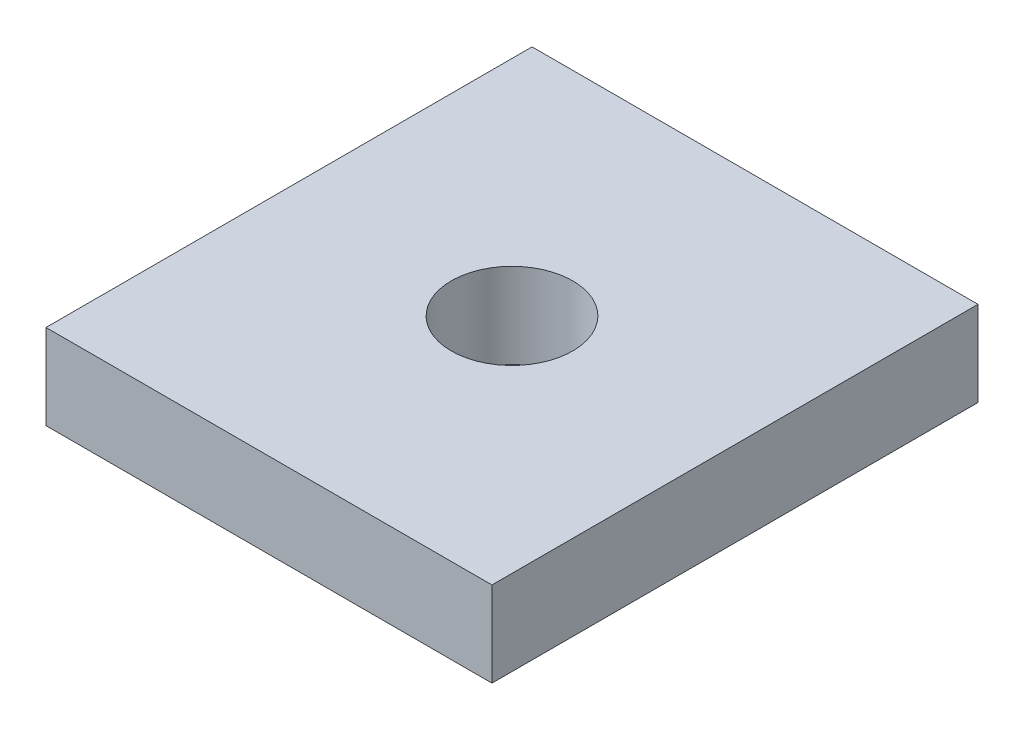
from build123d import *

# Parameters (mm, degrees)
CROQUIS1_W              = 36.7
CROQUIS1_H              = 40
CROQUIS1_R              = 5
SALIENTE_EXTRUIR1_DEPTH = 7


with BuildPart() as part:
    # Croquis1 → Saliente-Extruir1 (new body)
    with BuildSketch(Plane(origin=(0, 0, 0), x_dir=(1, 0, 0), z_dir=(0, 1, 0))):
        Rectangle(CROQUIS1_W, CROQUIS1_H)
        Circle(CROQUIS1_R, mode=Mode.SUBTRACT)
    extrude(amount=SALIENTE_EXTRUIR1_DEPTH)


solid = part.part
